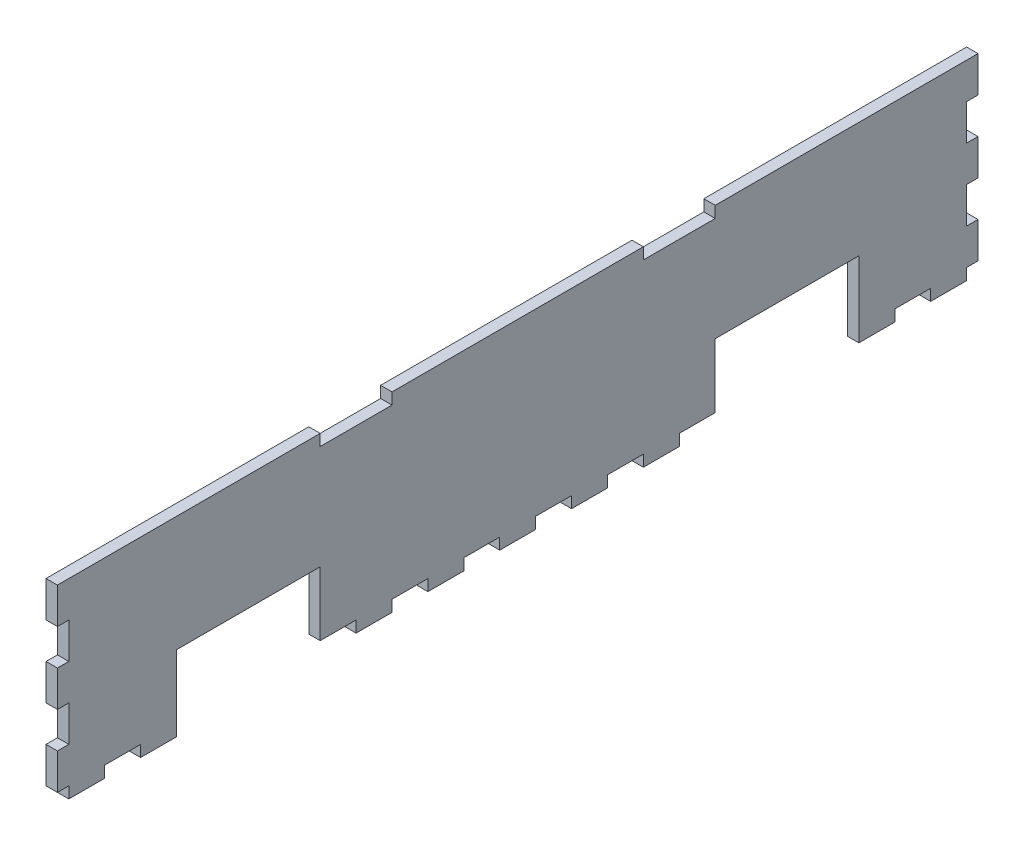
from build123d import *

# Parameters (mm, degrees)
ESQUISSE1_W                = 250
ESQUISSE1_H                = 50
BOSS_EXTRU_1_DEPTH         = 3.175
ESQUISSE2_W                = 10
ESQUISSE2_H                = 3.175
BOSS_EXTRU_2_DEPTH         = 3.175
R_P_TITION_LIN_AIRE1_COUNT = 13
R_P_TITION_LIN_AIRE1_PITCH = 20
ESQUISSE4_W                = 40
ESQUISSE4_H                = 21
ESQUISSE4_W_2              = 20
ESQUISSE4_H_2              = 3.175
ENL_V_MAT_EXTRU_1_DEPTH    = 3.175
ESQUISSE5_W                = 3.175
ESQUISSE5_H                = 10
BOSS_EXTRU_3_DEPTH         = 3.175
R_P_TITION_LIN_AIRE2_COUNT = 3
R_P_TITION_LIN_AIRE2_PITCH = 20


with BuildPart() as part:
    # Esquisse1 → Boss.-Extru.1 (new body)
    with BuildSketch(Plane(origin=(0, 0, 0), x_dir=(0, 0, -1), z_dir=(1, 0, 0))):
        with Locations((125, 25)):
            Rectangle(ESQUISSE1_W, ESQUISSE1_H)
    extrude(amount=BOSS_EXTRU_1_DEPTH)

    # Esquisse2 → Boss.-Extru.2 (add)
    with BuildSketch(Plane(origin=(3.175, 0, 0), x_dir=(0, 0, -1), z_dir=(1, 0, 0))):
        with Locations((5, -1.5875)):
            Rectangle(ESQUISSE2_W, ESQUISSE2_H)
    boss_extru_2 = extrude(amount=-BOSS_EXTRU_2_DEPTH)

    # Répétition linéaire1: Boss.-Extru.2 ×13
    with Locations(*[(0, 0, -i * R_P_TITION_LIN_AIRE1_PITCH) for i in range(1, R_P_TITION_LIN_AIRE1_COUNT)]):
        add(boss_extru_2)

    # Esquisse4 → Enlèv. mat.-Extru.1 (cut)
    with BuildSketch(Plane(origin=(3.175, 0, 0), x_dir=(0, 0, -1), z_dir=(1, 0, 0))):
        with Locations((50, 7.325)):
            Rectangle(ESQUISSE4_W, ESQUISSE4_H)
        with Locations((200, 7.325)):
            Rectangle(ESQUISSE4_W, ESQUISSE4_H)
        with Locations((80, 48.4125)):
            Rectangle(ESQUISSE4_W_2, ESQUISSE4_H_2)
        with Locations((170, 48.4125)):
            Rectangle(ESQUISSE4_W_2, ESQUISSE4_H_2)
    extrude(amount=-ENL_V_MAT_EXTRU_1_DEPTH, mode=Mode.SUBTRACT)

    # Esquisse5 → Boss.-Extru.3 (add)
    with BuildSketch(Plane(origin=(3.175, 0, 0), x_dir=(0, 0, -1), z_dir=(1, 0, 0))):
        with Locations((-1.5875, 45)):
            Rectangle(ESQUISSE5_W, ESQUISSE5_H)
        with Locations((251.5875, 45)):
            Rectangle(ESQUISSE5_W, ESQUISSE5_H)
    boss_extru_3 = extrude(amount=-BOSS_EXTRU_3_DEPTH)

    # Répétition linéaire2: Boss.-Extru.3 ×3
    with Locations(*[(0, -i * R_P_TITION_LIN_AIRE2_PITCH, 0) for i in range(1, R_P_TITION_LIN_AIRE2_COUNT)]):
        add(boss_extru_3)


solid = part.part
